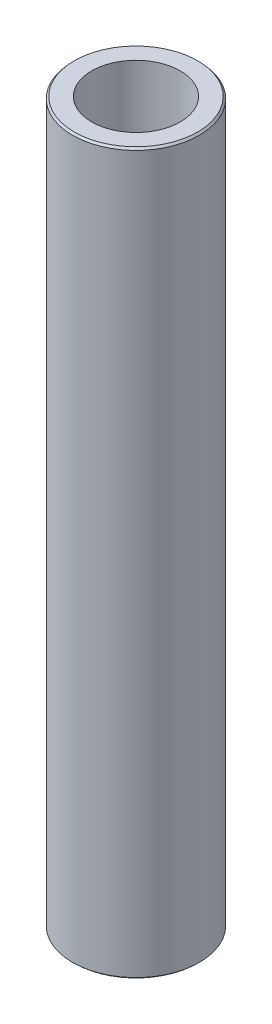
from build123d import *
from OCP.BRepFilletAPI import BRepFilletAPI_MakeChamfer

# Parameters (mm, degrees)
SKETCH1_R           = 45
BOSS_EXTRUDE1_DEPTH = 510.44863491
SKETCH2_R           = 31.392718821
CUT_EXTRUDE1_DEPTH  = 515.400436315
CHAMFER1_SIZE       = 1.369875828
CHAMFER1_SIZE2      = 1.245904661


with BuildPart() as part:
    # Sketch1 → Boss-Extrude1 (new body)
    with BuildSketch(Plane(origin=(0, 0, 0), x_dir=(1, 0, 0), z_dir=(0, 1, 0))):
        Circle(SKETCH1_R)
    extrude(amount=BOSS_EXTRUDE1_DEPTH)

    # Sketch2 → Cut-Extrude1 (cut, through all)
    with BuildSketch(Plane(origin=(0, 0, 0), x_dir=(1, 0, 0), z_dir=(0, 1, 0))):
        Circle(SKETCH2_R)
    extrude(amount=CUT_EXTRUDE1_DEPTH, mode=Mode.SUBTRACT)

    # Chamfer1: one chamfer whose edges measure the first distance from different faces: ONE call of the kernel's chamfer builder (chamfer() names one face for all edges)
    chamfer1_edges_1 = [part.edges().sort_by_distance(p)[0] for p in [
        (-45, 510.44863491, 0),
    ]]
    chamfer1_side_1 = [part.faces().sort_by_distance(p)[0] for p in [
        (-45, 255.224317455, 0),
    ]]
    chamfer1_edges_2 = [part.edges().sort_by_distance(p)[0] for p in [
        (-45, 0, 0),
    ]]
    chamfer1_side_2 = [part.faces().sort_by_distance(p)[0] for p in [
        (-43.727207794, 0, 0),
    ]]
    chamfer1 = BRepFilletAPI_MakeChamfer(part.part.solid().wrapped)
    for e in chamfer1_edges_1:
        chamfer1.Add(CHAMFER1_SIZE, CHAMFER1_SIZE2, e.wrapped, chamfer1_side_1[0].wrapped)  # the first distance lies on this face
    for e in chamfer1_edges_2:
        chamfer1.Add(CHAMFER1_SIZE, CHAMFER1_SIZE2, e.wrapped, chamfer1_side_2[0].wrapped)  # the first distance lies on this face
    add(Compound.cast(chamfer1.Shape()), mode=Mode.REPLACE)


solid = part.part
